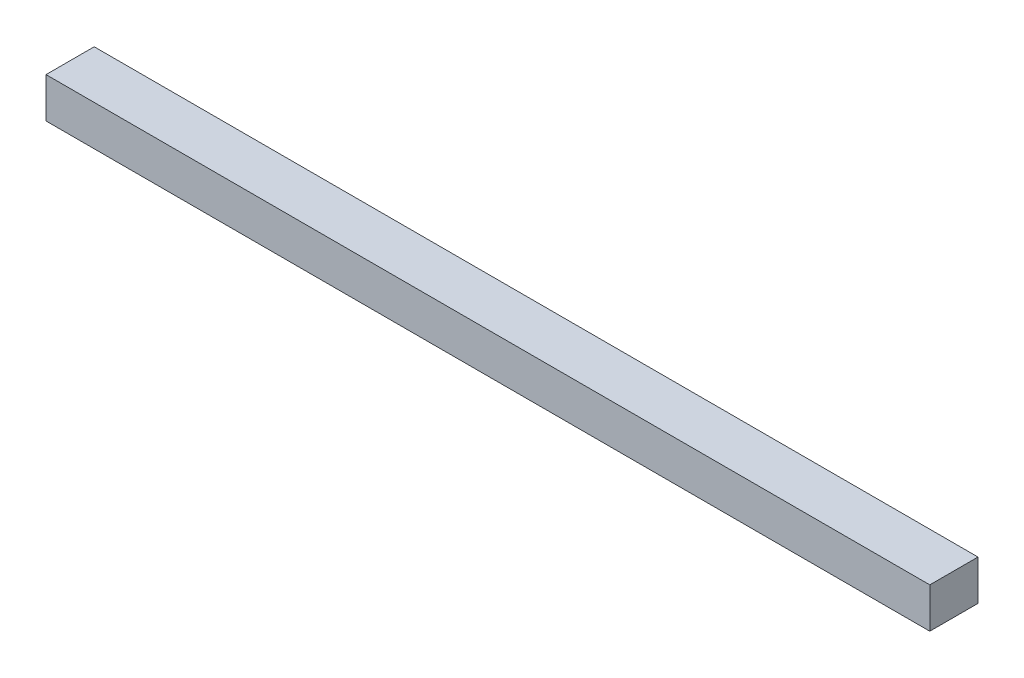
from build123d import *

# Parameters (mm, degrees)
SKETCH_2_W      = 30
SKETCH_2_H      = 25
EXTRUDE_1_DEPTH = 550


with BuildPart() as part:
    # Эскиз2 → Бобышка-Вытянуть1 (new body)
    with BuildSketch(Plane(origin=(0, 0, 0), x_dir=(0, 0, -1), z_dir=(1, 0, 0))):
        Rectangle(SKETCH_2_W, SKETCH_2_H)
    extrude(amount=EXTRUDE_1_DEPTH)


solid = part.part
